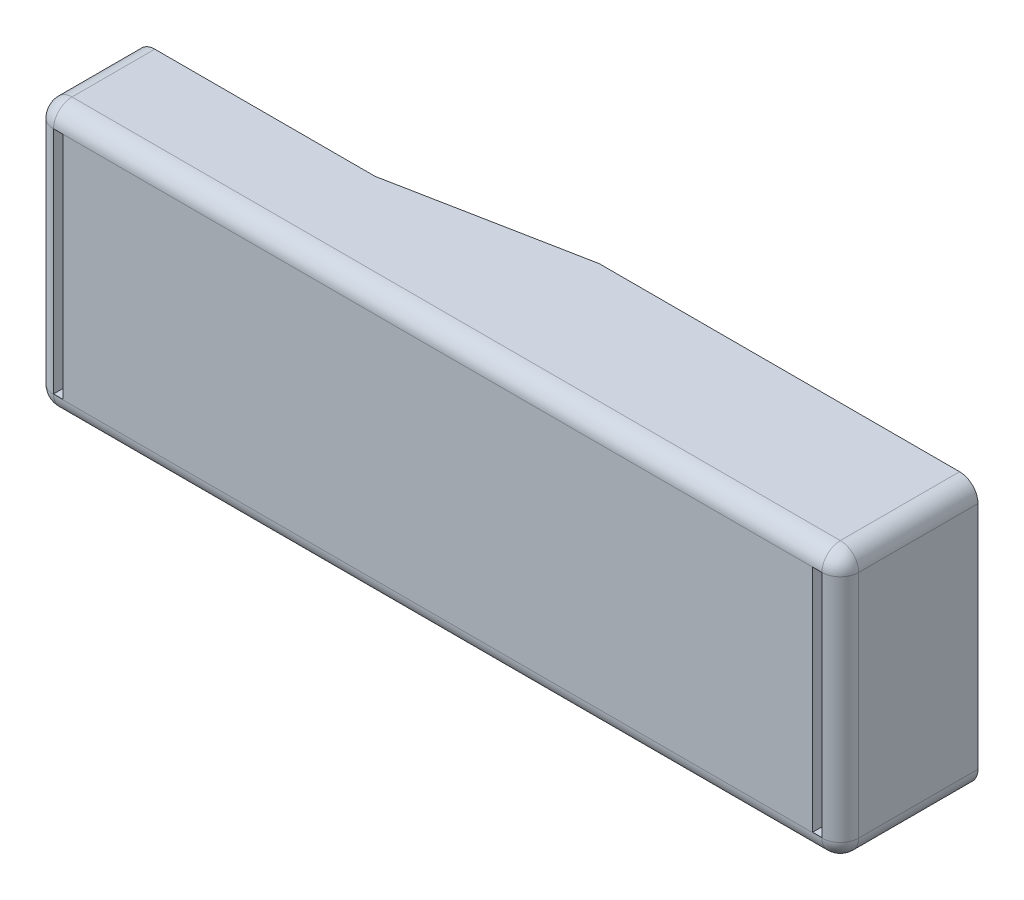
from build123d import *

# Parameters (mm, degrees)
BOSS_EXTRUDE1_DEPTH = 14.5
BOSS_EXTRUDE2_DEPTH = 2
SKETCH9_W           = 1
SKETCH9_H           = 24.94924747
CUT_EXTRUDE7_DEPTH  = 11
SKETCH15_W          = 2
SKETCH15_H          = 25
BOSS_EXTRUDE5_DEPTH = 3.96257304
SKETCH16_W          = 5
SKETCH16_H          = 18
CUT_EXTRUDE8_DEPTH  = 2
FILLET2_R           = 2
SKETCH17_W          = 1
SKETCH17_H          = 20
BOSS_EXTRUDE6_DEPTH = 7


with BuildPart() as part:
    # Sketch1 → Boss-Extrude1 (new, symmetric)
    with BuildSketch(Plane(origin=(0, 0, 0), x_dir=(1, 0, 0), z_dir=(0, 1, 0))):
        Polygon((-43.75, 5.5), (-43.75, -5.5), (43.75, -5.5), (43.75, 5.5), (38.75, 5.5), (38.75, 3.5), (38.75, -3.5), (-38.75, -3.5), (-38.75, 3.5), (-38.75, 5.5), align=None)
    extrude(amount=BOSS_EXTRUDE1_DEPTH, both=True)

    # Sketch8 → Boss-Extrude2 (add)
    with BuildSketch(Plane.XZ.offset(14.5)):
        Polygon((-43.75, 1), (-43.75, -5.5), (-23.804915393, -5.5), (-17.812461495, -5.5), (2.574976796, -9.46257304), (43.75, -9.46257304), (43.75, -8.5), (43.75, -4.5), (43.75, -3), (43.75, -0.96257304), (43.75, 5.5), (-43.75, 5.5), (-43.75, 3), align=None)
    boss_extrude2 = extrude(amount=-BOSS_EXTRUDE2_DEPTH)

    # Mirror1: Boss-Extrude2 across plane
    add(boss_extrude2.mirror(Plane.ZX))

    # Sketch9 → Cut-Extrude7 (cut)
    with BuildSketch(Plane(origin=(0, 0, -5.5), x_dir=(-1, 0, 0), z_dir=(0, 0, -1))):
        with Locations((-41.25, 0.025376265)):
            Rectangle(SKETCH9_W, SKETCH9_H)
        with Locations((41.25, 0.025376265)):
            Rectangle(SKETCH9_W, SKETCH9_H)
    extrude(amount=-CUT_EXTRUDE7_DEPTH, mode=Mode.SUBTRACT)

    # Sketch15 → Boss-Extrude5 (add)
    with BuildSketch(Plane(origin=(0, 0, -5.5), x_dir=(-1, 0, 0), z_dir=(0, 0, -1))):
        with Locations((-42.75, 0)):
            Rectangle(SKETCH15_W, SKETCH15_H)
        with Locations((-39.75, 0)):
            Rectangle(SKETCH15_W, SKETCH15_H)
    extrude(amount=BOSS_EXTRUDE5_DEPTH)

    # Sketch16 → Cut-Extrude8 (cut)
    with BuildSketch(Plane.ZY.offset(-38.75)):
        with Locations((-6.96257304, 0)):
            Rectangle(SKETCH16_W, SKETCH16_H)
    extrude(amount=-CUT_EXTRUDE8_DEPTH, mode=Mode.SUBTRACT)

    # Fillet2
    fillet2_edges = [part.edges().sort_by_distance(p)[0] for p in [
        (43.75, -14.5, -1.98128652),
        (0, -14.5, 5.5),
        (-43.75, -14.5, 0),
        (43.75, 0, 5.5),
        (-43.75, 0, 5.5),
        (-43.75, 14.5, 0),
        (0, 14.5, 5.5),
        (43.75, 14.5, -1.98128652),
    ]]
    fillet(fillet2_edges, radius=FILLET2_R - 0.0001)  # a hair under: the kernel refuses the full size

    # Sketch17 → Boss-Extrude6 (add)
    with BuildSketch(Plane(origin=(0, 0, 3.5), x_dir=(-1, 0, 0), z_dir=(0, 0, -1))):
        with Locations((-13.25, -2.5)):
            Rectangle(SKETCH17_W, SKETCH17_H)
        with Locations((13.25, -2.5)):
            Rectangle(SKETCH17_W, SKETCH17_H)
    extrude(amount=BOSS_EXTRUDE6_DEPTH)


solid = part.part
